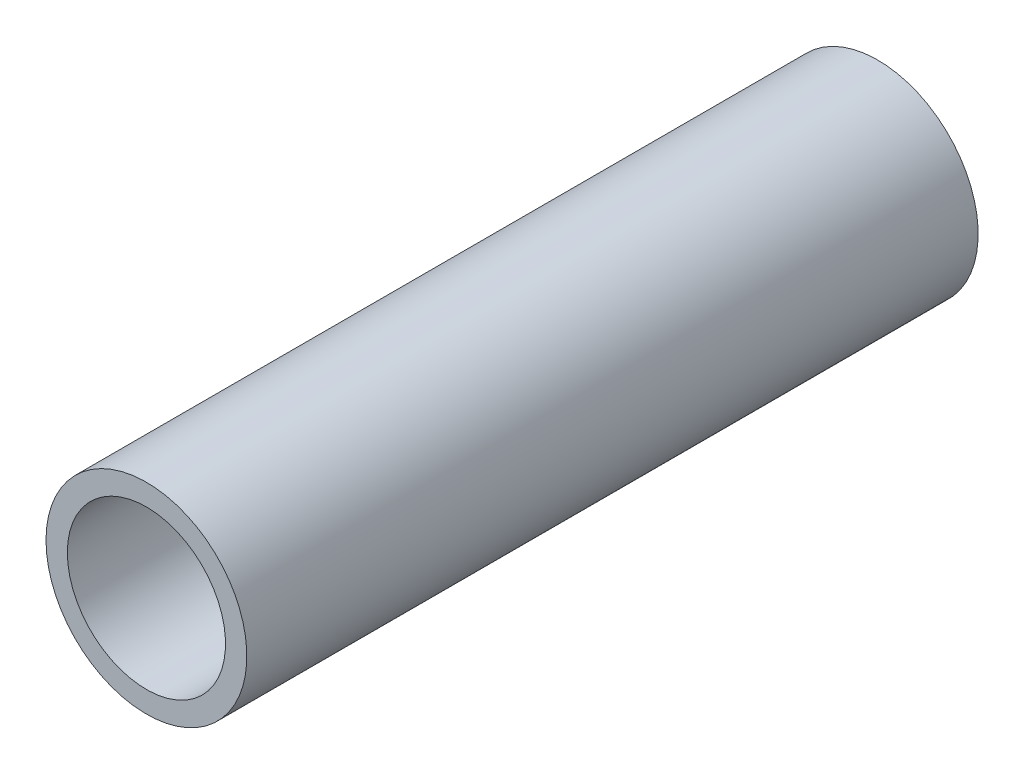
from build123d import *

# Parameters (mm, degrees)
SKETCH1_R           = 4
SKETCH1_R_2         = 3.15
BOSS_EXTRUDE1_DEPTH = 29.13


with BuildPart() as part:
    # Sketch1 → Boss-Extrude1 (new body)
    with BuildSketch(Plane.XY):
        Circle(SKETCH1_R)
        Circle(SKETCH1_R_2, mode=Mode.SUBTRACT)
    extrude(amount=BOSS_EXTRUDE1_DEPTH)


solid = part.part
